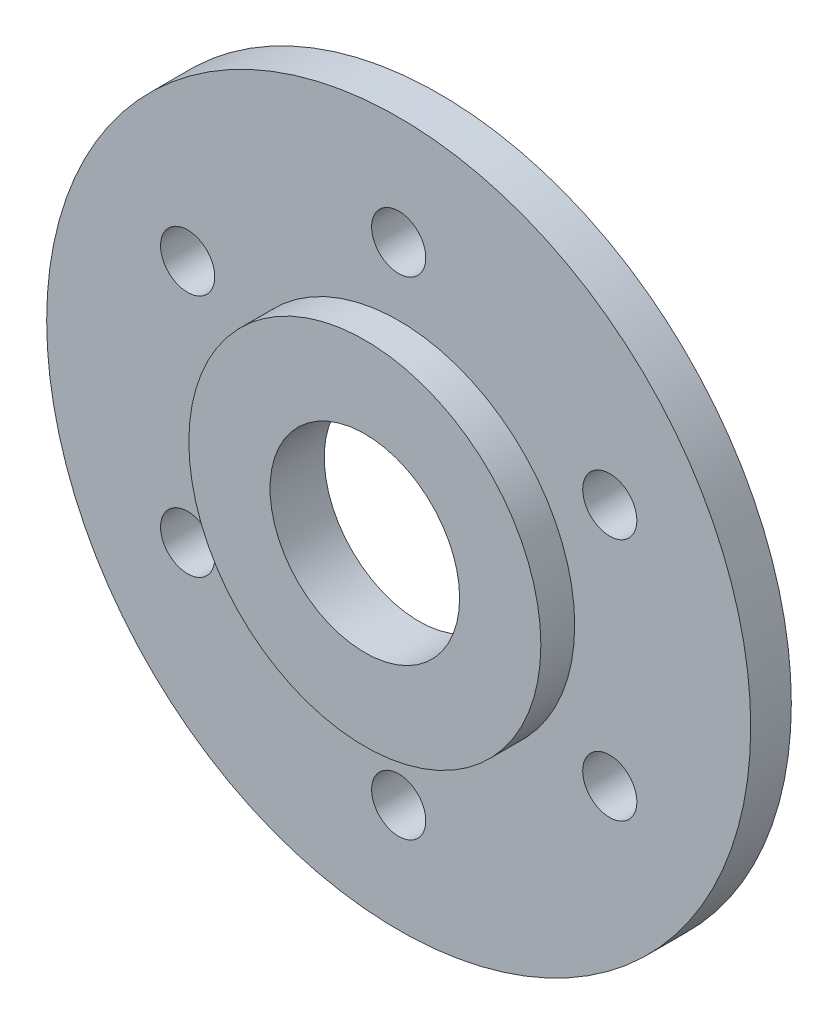
from build123d import *

# Parameters (mm, degrees)
CROQUIS1_R              = 13
CROQUIS1_R_2            = 7
SALIENTE_EXTRUIR1_DEPTH = 4
CROQUIS2_R              = 26
CROQUIS2_R_2            = 11.25
SALIENTE_EXTRUIR2_DEPTH = 1.5
CROQUIS3_R              = 2
CORTAR_EXTRUIR1_DEPTH   = 38.17862289


with BuildPart() as part:
    # Croquis1 → Saliente-Extruir1 (new body)
    with BuildSketch(Plane.XY):
        Circle(CROQUIS1_R)
        Circle(CROQUIS1_R_2, mode=Mode.SUBTRACT)
    extrude(amount=SALIENTE_EXTRUIR1_DEPTH)


with BuildPart() as body_2:
    # Croquis2 → Saliente-Extruir2 (new, symmetric)
    with BuildSketch(Plane(origin=(0, 0, 0), x_dir=(-1, 0, 0), z_dir=(0, 0, -1))):
        Circle(CROQUIS2_R)
        Circle(CROQUIS2_R_2, mode=Mode.SUBTRACT)
    extrude(amount=SALIENTE_EXTRUIR2_DEPTH, both=True)

    # Croquis3 → Cortar-Extruir1 (cut, through all)
    with BuildSketch(Plane(origin=(0, 0, -1.5), x_dir=(-1, 0, 0), z_dir=(0, 0, -1))):
        with Locations((0, 18)):
            Circle(CROQUIS3_R)
        with Locations((15.588457268, 9)):
            Circle(CROQUIS3_R)
        with Locations((15.588457268, -9)):
            Circle(CROQUIS3_R)
        with Locations((0, -18)):
            Circle(CROQUIS3_R)
        with Locations((-15.588457268, -9)):
            Circle(CROQUIS3_R)
        with Locations((-15.588457268, 9)):
            Circle(CROQUIS3_R)
    extrude(amount=-CORTAR_EXTRUIR1_DEPTH, mode=Mode.SUBTRACT)


solid = Compound([part.part, body_2.part])
